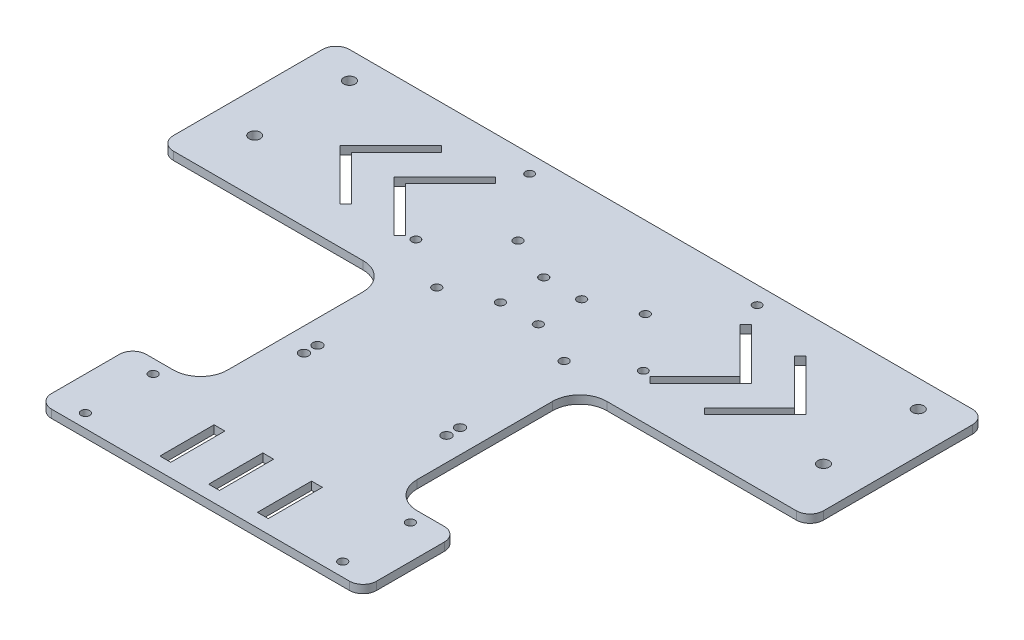
from build123d import *

# Parameters (mm, degrees)
SKETCH_1_R            = 2.1
EXTRUDE_1_DEPTH       = 3
SKETCH_3_R            = 1.6
CUT_EXTRUDE_1_DEPTH   = 125.359358313
EXTRUDE_2_DEPTH       = 3
FILLET_1_R            = 10
SKETCH_5_R            = 1.6
SKETCH_5_W            = 4
SKETCH_5_H            = 20
CUT_EXTRUDE_2_DEPTH   = 183.524655869
FILLET_2_R            = 10
CUT_EXTRUDE_1_2_DEPTH = 183.524655869
SKETCH_8_R            = 1.75
CUT_EXTRUDE_5_DEPTH   = 183.524655869
SKETCH_9_R            = 1.55
CUT_EXTRUDE_6_DEPTH   = 183.524655869
FILLET_3_R            = 5


with BuildPart() as part:
    # 草图1 → 凸台-拉伸1 (new body)
    with BuildSketch(Plane(origin=(0, 0, 0), x_dir=(1, 0, 0), z_dir=(0, 1, 0))):
        Polygon((-120, 32.5), (-120, -32.5), (-60, -32.5), (20, -32.5), (120, -32.5), (120, 32.5), align=None)
        with Locations((-105, -12.5)):
            Circle(SKETCH_1_R, mode=Mode.SUBTRACT)
        with Locations((105, -12.5)):
            Circle(SKETCH_1_R, mode=Mode.SUBTRACT)
        with Locations((-105, 22.5)):
            Circle(SKETCH_1_R, mode=Mode.SUBTRACT)
        with Locations((105, 22.5)):
            Circle(SKETCH_1_R, mode=Mode.SUBTRACT)
    extrude(amount=EXTRUDE_1_DEPTH)

    # 草图3 → Cut-Extrude 1 (cut, through all)
    with BuildSketch(Plane(origin=(0, 3, 0), x_dir=(1, 0, 0), z_dir=(0, 1, 0))):
        with Locations((-22.773937698, 2.5)):
            Circle(SKETCH_3_R)
        with Locations((24.226062302, 2.5)):
            Circle(SKETCH_3_R)
        with Locations((24.226062302, -27.5)):
            Circle(SKETCH_3_R)
        with Locations((-22.773937698, -27.5)):
            Circle(SKETCH_3_R)
        with Locations((-6.273937698, -4.5)):
            Circle(SKETCH_3_R)
        with Locations((7.726062302, -4.5)):
            Circle(SKETCH_3_R)
        with Locations((7.726062302, -20.5)):
            Circle(SKETCH_3_R)
        with Locations((-6.273937698, -20.5)):
            Circle(SKETCH_3_R)
    extrude(amount=-CUT_EXTRUDE_1_DEPTH, mode=Mode.SUBTRACT)

    # 草图4 → 凸台-拉伸2 (add)
    with BuildSketch(Plane(origin=(0, 0, 0), x_dir=(1, 0, 0), z_dir=(0, 1, 0))):
        Polygon((0, -32.5), (-35, -32.5), (-35, -102.5), (-60, -102.5), (-60, -137.5), (60, -137.5), (60, -102.5), (35, -102.5), (35, -32.5), align=None)
    extrude(amount=EXTRUDE_2_DEPTH)

    # 圆角1
    fillet_1_edges = [part.edges().sort_by_distance(p)[0] for p in [
        (35, 1.5, 32.5),
        (-35, 1.5, 32.5),
    ]]
    fillet(fillet_1_edges, radius=FILLET_1_R)

    # 草图5 → 切除-拉伸2 (cut, through all)
    with BuildSketch(Plane(origin=(0, 3, 0), x_dir=(1, 0, 0), z_dir=(0, 1, 0))):
        with Locations((-47.5, -132.5)):
            Circle(SKETCH_5_R)
        with Locations((47.5, -132.5)):
            Circle(SKETCH_5_R)
        with Locations((-47.5, -107.5)):
            Circle(SKETCH_5_R)
        with Locations((47.5, -107.5)):
            Circle(SKETCH_5_R)
        with Locations((0, -122.5)):
            Rectangle(SKETCH_5_W, SKETCH_5_H)
        with Locations((-18, -122.5)):
            Rectangle(SKETCH_5_W, SKETCH_5_H)
        with Locations((18, -122.5)):
            Rectangle(SKETCH_5_W, SKETCH_5_H)
    extrude(amount=-CUT_EXTRUDE_2_DEPTH, mode=Mode.SUBTRACT)

    # 圆角2
    fillet_2_edges = [part.edges().sort_by_distance(p)[0] for p in [
        (35, 1.5, 102.5),
        (-35, 1.5, 102.5),
    ]]
    fillet(fillet_2_edges, radius=FILLET_2_R)

    # 草图7 → Cut-Extrude 1 2 (cut, through all)
    with BuildSketch(Plane(origin=(0, 3, 0), x_dir=(1, 0, 0), z_dir=(0, 1, 0))):
        Polygon((-45.148639148, -16.617009358), (-61.765648506, 0), (-45.148639148, 16.617009358), (-47.269959491, 18.738329701), (-66.008289193, 0), (-47.269959491, -18.738329701), align=None)
        Polygon((-65.148639148, -16.617009358), (-81.765648506, 0), (-65.148639148, 16.617009358), (-67.269959491, 18.738329701), (-86.008289193, 0), (-67.269959491, -18.738329701), align=None)
        Polygon((65.148639148, 16.617009358), (81.765648506, 0), (65.148639148, -16.617009358), (67.269959491, -18.738329701), (86.008289193, 0), (67.269959491, 18.738329701), align=None)
        Polygon((45.148639148, 16.617009358), (61.765648506, 0), (45.148639148, -16.617009358), (47.269959491, -18.738329701), (66.008289193, 0), (47.269959491, 18.738329701), align=None)
    extrude(amount=-CUT_EXTRUDE_1_2_DEPTH, mode=Mode.SUBTRACT)

    # 草图8 → 切除-拉伸5 (cut, through all)
    with BuildSketch(Plane(origin=(0, 3, 0), x_dir=(1, 0, 0), z_dir=(0, 1, 0))):
        with Locations((-26.316332853, -68)):
            Circle(SKETCH_8_R)
        with Locations((-26.316332853, -73)):
            Circle(SKETCH_8_R)
        with Locations((26.316332853, -73)):
            Circle(SKETCH_8_R)
        with Locations((26.316332853, -68)):
            Circle(SKETCH_8_R)
    extrude(amount=-CUT_EXTRUDE_5_DEPTH, mode=Mode.SUBTRACT)

    # 草图9 → 切除-拉伸6 (cut, through all)
    with BuildSketch(Plane(origin=(0, 3, 0), x_dir=(1, 0, 0), z_dir=(0, 1, 0))):
        with Locations((-42, 26)):
            Circle(SKETCH_9_R)
        with Locations((-42, -16)):
            Circle(SKETCH_9_R)
        with Locations((42, -16)):
            Circle(SKETCH_9_R)
        with Locations((42, 26)):
            Circle(SKETCH_9_R)
    extrude(amount=-CUT_EXTRUDE_6_DEPTH, mode=Mode.SUBTRACT)

    # 圆角3
    fillet_3_edges = [part.edges().sort_by_distance(p)[0] for p in [
        (-60, 1.5, 102.5),
        (-60, 1.5, 137.5),
        (60, 1.5, 102.5),
        (60, 1.5, 137.5),
        (120, 1.5, -32.5),
        (120, 1.5, 32.5),
        (-120, 1.5, 32.5),
        (-120, 1.5, -32.5),
    ]]
    fillet(fillet_3_edges, radius=FILLET_3_R)


solid = part.part
